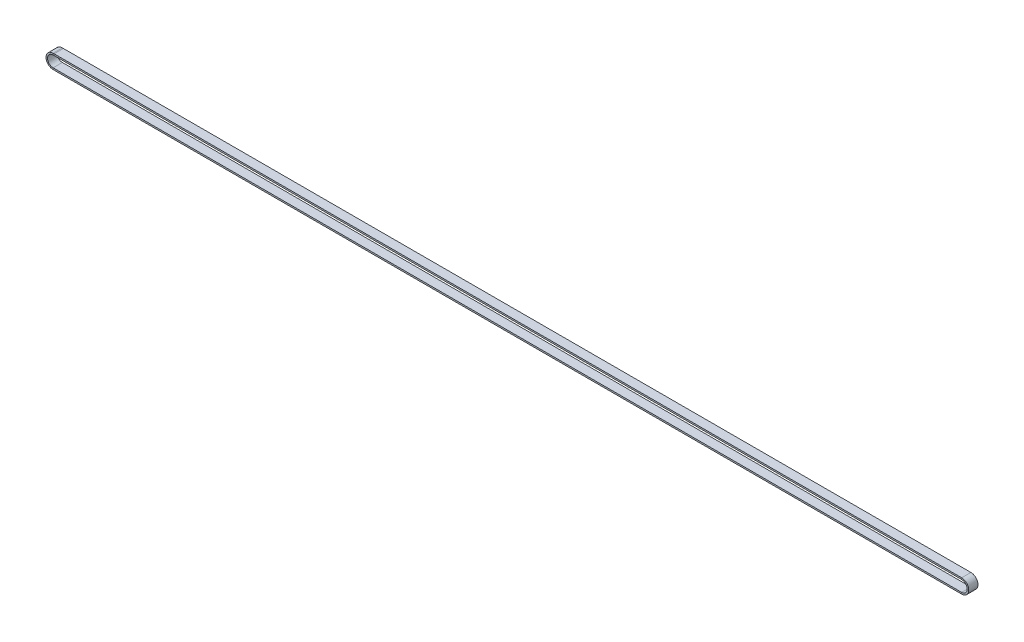
from build123d import *

# Parameters (mm, degrees)
SKETCH3_W = 9
SKETCH3_H = 1.5


with BuildPart() as part:
    # Sweep1: sweep along a path in Sketch2
    with BuildLine(Plane.XY.offset(-110.233366658)) as sweep1_path:
        Line((-1, 48.84305606), (883.520637828, 48.84305606))
        ThreePointArc((883.520637828, 48.84305606), (890.420637828, 41.94305606), (883.520637828, 35.04305606))
        Line((883.520637828, 35.04305606), (-1, 35.04305606))
        ThreePointArc((-1, 35.04305606), (-7.9, 41.94305606), (-1, 48.84305606))
    # Sketch3 → Sweep1 (sweep)
    with BuildSketch(Plane(origin=(0, 0, 0), x_dir=(0, 0, -1), z_dir=(1, 0, 0))):
        with Locations((105.733366658, 48.09305606)):
            Rectangle(SKETCH3_W, SKETCH3_H)
    sweep(path=sweep1_path.line)


solid = part.part
